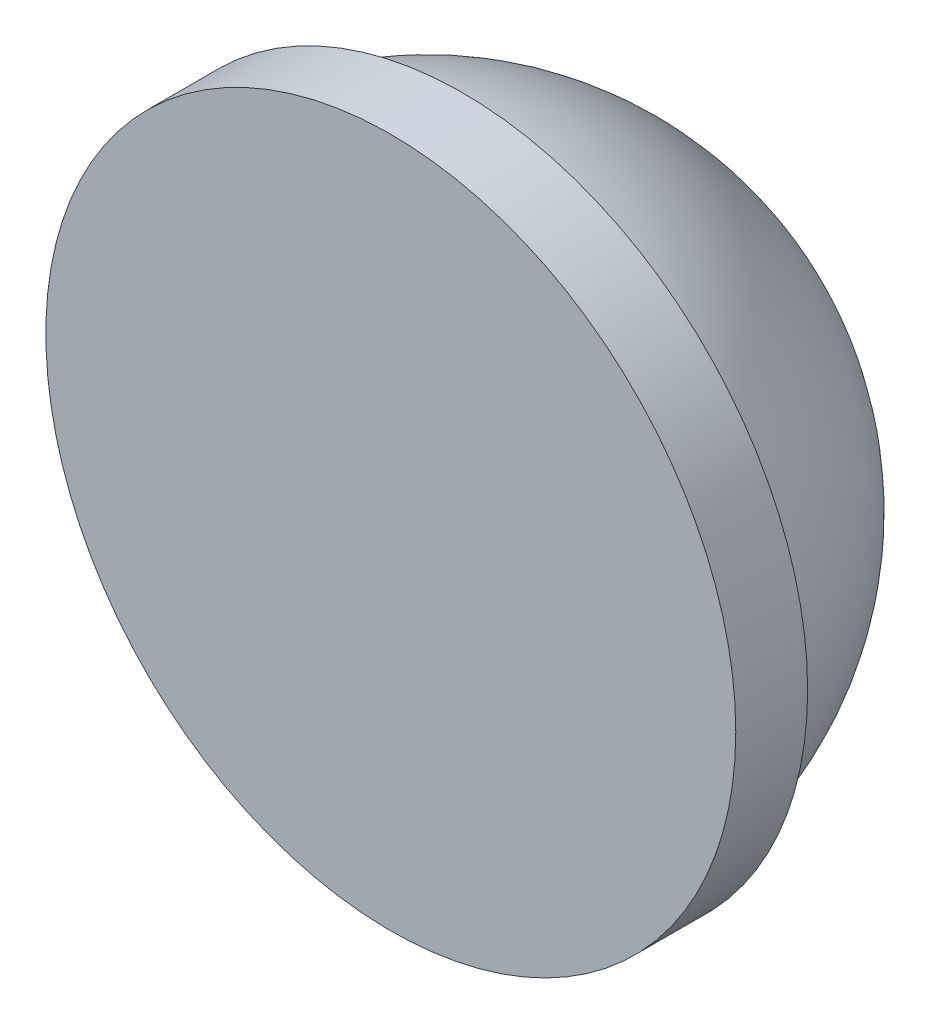
from build123d import *


with BuildPart() as part:
    # Esquisse2 → Révolution1 (revolve)
    with BuildSketch(Plane(origin=(0, 0, 0), x_dir=(0, 0, -1), z_dir=(1, 0, 0))):
        with BuildLine():
            Line((-0.5, 0), (4.5, 0))
            ThreePointArc((4.5, 0), (3.354101966, 3), (0.5, 4.472135955))
            Line((0.5, 4.472135955), (0.5, 4.8))
            Line((0.5, 4.8), (-0.5, 4.8))
            Line((-0.5, 4.8), (-0.5, 0))
        make_face()
    revolve(axis=Axis((0, 0, 0.5), (0, 0, -1)))


solid = part.part
